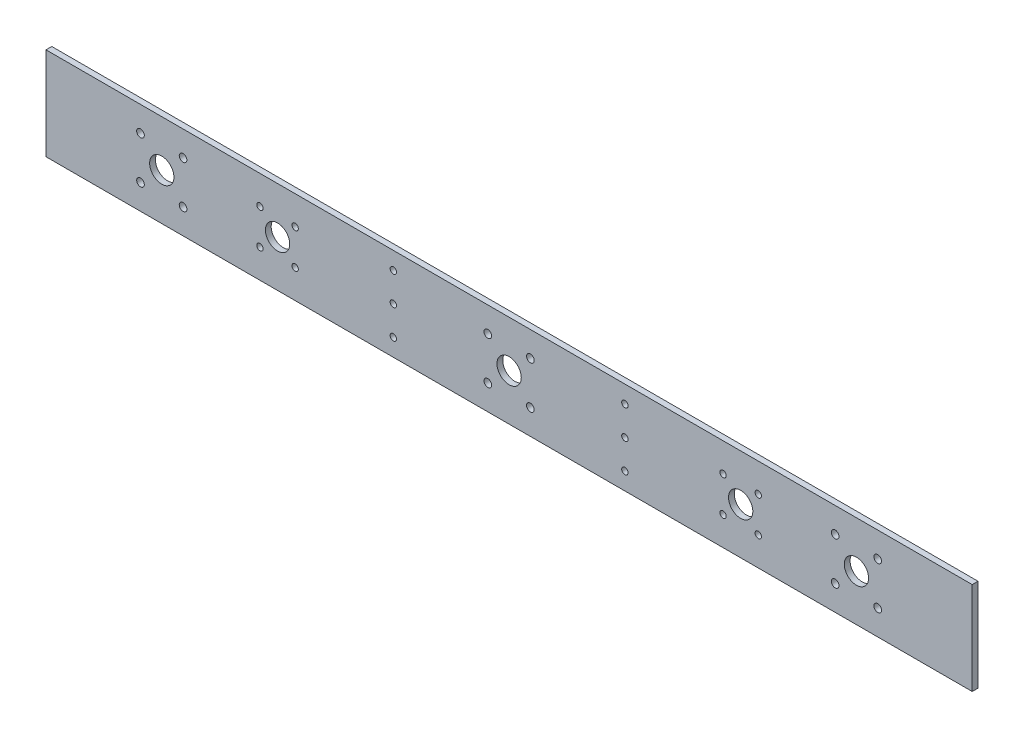
from build123d import *

# Parameters (mm, degrees)
SKETCH_1_W      = 800
SKETCH_1_H      = 80
SKETCH_1_R      = 3.3
SKETCH_1_R_2    = 2.75
SKETCH_1_R_3    = 10.5
EXTRUDE_1_DEPTH = 5


with BuildPart() as part:
    # 草图1 → 凸台-拉伸1 (new body)
    with BuildSketch(Plane.XY):
        Rectangle(SKETCH_1_W, SKETCH_1_H)
        with Locations((-318.384776311, 18.384776311)):
            Circle(SKETCH_1_R, mode=Mode.SUBTRACT)
        with Locations((-281.615223689, 18.384776311)):
            Circle(SKETCH_1_R, mode=Mode.SUBTRACT)
        with Locations((-281.615223689, -18.384776311)):
            Circle(SKETCH_1_R, mode=Mode.SUBTRACT)
        with Locations((-318.384776311, -18.384776311)):
            Circle(SKETCH_1_R, mode=Mode.SUBTRACT)
        with Locations((-215.202795796, 15.202795796)):
            Circle(SKETCH_1_R_2, mode=Mode.SUBTRACT)
        with Locations((-184.797204204, 15.202795796)):
            Circle(SKETCH_1_R_2, mode=Mode.SUBTRACT)
        with Locations((-184.797204204, -15.202795796)):
            Circle(SKETCH_1_R_2, mode=Mode.SUBTRACT)
        with Locations((-215.202795796, -15.202795796)):
            Circle(SKETCH_1_R_2, mode=Mode.SUBTRACT)
        with Locations((-200, 0)):
            Circle(SKETCH_1_R_3, mode=Mode.SUBTRACT)
        with Locations((-18.384776311, 18.384776311)):
            Circle(SKETCH_1_R, mode=Mode.SUBTRACT)
        with Locations((18.384776311, 18.384776311)):
            Circle(SKETCH_1_R, mode=Mode.SUBTRACT)
        with Locations((18.384776311, -18.384776311)):
            Circle(SKETCH_1_R, mode=Mode.SUBTRACT)
        with Locations((-18.384776311, -18.384776311)):
            Circle(SKETCH_1_R, mode=Mode.SUBTRACT)
        with Locations((215.202795796, -15.202795796)):
            Circle(SKETCH_1_R_2, mode=Mode.SUBTRACT)
        with Locations((184.797204204, -15.202795796)):
            Circle(SKETCH_1_R_2, mode=Mode.SUBTRACT)
        with Locations((184.797204204, 15.202795796)):
            Circle(SKETCH_1_R_2, mode=Mode.SUBTRACT)
        with Locations((215.202795796, 15.202795796)):
            Circle(SKETCH_1_R_2, mode=Mode.SUBTRACT)
        with Locations((200, 0)):
            Circle(SKETCH_1_R_3, mode=Mode.SUBTRACT)
        with Locations((318.384776311, -18.384776311)):
            Circle(SKETCH_1_R, mode=Mode.SUBTRACT)
        with Locations((281.615223689, -18.384776311)):
            Circle(SKETCH_1_R, mode=Mode.SUBTRACT)
        with Locations((281.615223689, 18.384776311)):
            Circle(SKETCH_1_R, mode=Mode.SUBTRACT)
        with Locations((318.384776311, 18.384776311)):
            Circle(SKETCH_1_R, mode=Mode.SUBTRACT)
        with Locations((-100, 25)):
            Circle(SKETCH_1_R_2, mode=Mode.SUBTRACT)
        with Locations((-100, 0)):
            Circle(SKETCH_1_R_2, mode=Mode.SUBTRACT)
        with Locations((-100, -25)):
            Circle(SKETCH_1_R_2, mode=Mode.SUBTRACT)
        with Locations((100, -25)):
            Circle(SKETCH_1_R_2, mode=Mode.SUBTRACT)
        with Locations((100, 0)):
            Circle(SKETCH_1_R_2, mode=Mode.SUBTRACT)
        with Locations((100, 25)):
            Circle(SKETCH_1_R_2, mode=Mode.SUBTRACT)
        with Locations((-300, 0)):
            Circle(SKETCH_1_R_3, mode=Mode.SUBTRACT)
        Circle(SKETCH_1_R_3, mode=Mode.SUBTRACT)
        with Locations((300, 0)):
            Circle(SKETCH_1_R_3, mode=Mode.SUBTRACT)
    extrude(amount=EXTRUDE_1_DEPTH)


solid = part.part
